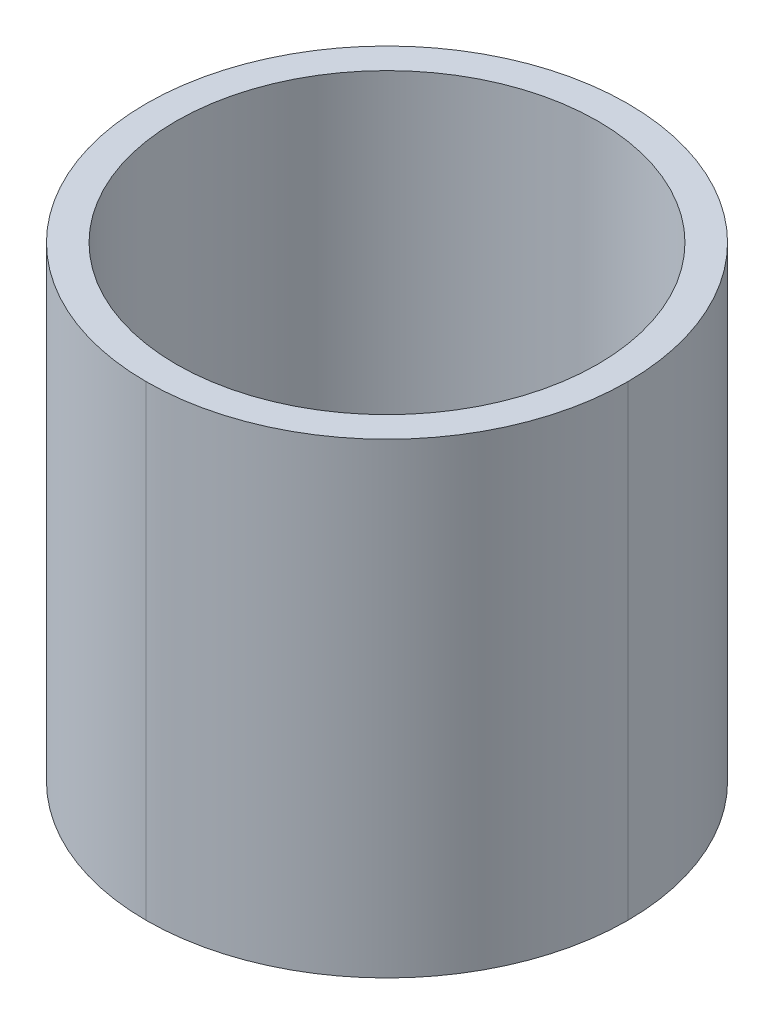
from build123d import *

# Parameters (mm, degrees)
SKETCH1_W           = 101.6
SKETCH1_H           = 101.6
BOSS_EXTRUDE1_DEPTH = 98.425
SKETCH2_R           = 44.45
CUT_EXTRUDE1_DEPTH  = 69.85
SKETCH3_R           = 10.16
CUT_EXTRUDE2_DEPTH  = 25.4
FILLET1_R           = 50.8


with BuildPart() as part:
    # Sketch1 → Boss-Extrude1 (new body)
    with BuildSketch(Plane(origin=(0, 0, 0), x_dir=(1, 0, 0), z_dir=(0, 1, 0))):
        with Locations((50.8, -50.8)):
            Rectangle(SKETCH1_W, SKETCH1_H)
    extrude(amount=BOSS_EXTRUDE1_DEPTH)

    # Sketch2 → Cut-Extrude1 (cut)
    with BuildSketch(Plane(origin=(0, 98.425, 0), x_dir=(1, 0, 0), z_dir=(0, 1, 0))):
        with Locations(Location((50.8, -50.8, 0), (0, 0, 270))):
            Circle(SKETCH2_R)
    extrude(amount=-CUT_EXTRUDE1_DEPTH, mode=Mode.SUBTRACT)

    # Sketch3 → Cut-Extrude2 (cut)
    with BuildSketch(Plane(origin=(0, 28.575, 0), x_dir=(1, 0, 0), z_dir=(0, 1, 0))):
        with Locations(Location((63.631609733, -73.025, 0), (0, 0, 270))):
            Circle(SKETCH3_R)
        with Locations(Location((25.136780535, -50.8, 0), (0, 0, 270))):
            Circle(SKETCH3_R)
        with Locations(Location((63.631609733, -28.575, 0), (0, 0, 270))):
            Circle(SKETCH3_R)
    extrude(amount=-CUT_EXTRUDE2_DEPTH, mode=Mode.SUBTRACT)

    # Fillet1
    fillet1_edges = [part.edges().sort_by_distance(p)[0] for p in [
        (0, 49.2125, 101.6),
        (0, 49.2125, 0),
        (101.6, 49.2125, 0),
        (101.6, 49.2125, 101.6),
    ]]
    fillet(fillet1_edges, radius=FILLET1_R - 0.0001)  # a hair under: the kernel refuses the full size


solid = part.part
